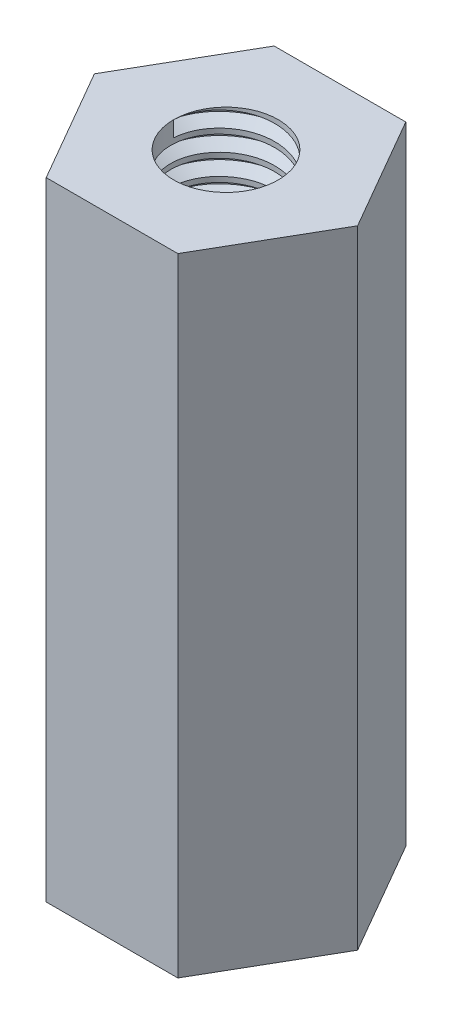
from build123d import *

# Parameters (mm, degrees)
SKETCH1_R           = 1.25
BOSS_EXTRUDE1_DEPTH = 15
THREAD1_PITCH       = 0.5


with BuildPart() as part:
    # Sketch1 → Boss-Extrude1 (new body)
    with BuildSketch(Plane(origin=(0, 0, 0), x_dir=(1, 0, 0), z_dir=(0, 1, 0))):
        Polygon((3.146558967, 0), (1.573279484, 2.725), (-1.573279484, 2.725), (-3.146558967, 0), (-1.573279484, -2.725), (1.573279484, -2.725), align=None)
        with Locations(Location((0, 0, 0), (0, 0, 270))):
            Circle(SKETCH1_R, mode=Mode.SUBTRACT)
    extrude(amount=BOSS_EXTRUDE1_DEPTH)

    # Thread1: the profile of Thread Profile1 profile screwed along a right-hand helix of 30 turns, 6 arcs to a turn; built about Z, then put on its axis
    thread1_z = Axis((0, 0, 0), (0, 0, 1))
    thread1_corners = [(1.2497, 0, -0.000173205), (1.520632938, 0, 0.156249999), (1.520632937, 0, 0.218749999), (1.2497, 0, 0.375173204)]
    with BuildLine(mode=Mode.PRIVATE) as thread1_profile:
        Line(thread1_corners[0], thread1_corners[1])
        Line(thread1_corners[1], thread1_corners[2])
        Line(thread1_corners[2], thread1_corners[3])
        Line(thread1_corners[3], thread1_corners[0])
    thread1_cap = Face(thread1_profile.wire())
    thread1_turn_angles = [0, 30, 60, 90, 120, 150, 180, 210, 240, 270, 300, 330, 360]
    thread1_turn_weights = [1, 0.8660254037844387, 1, 0.8660254037844387, 1, 0.8660254037844387, 1, 0.8660254037844387, 1, 0.8660254037844387, 1, 0.8660254037844387, 1]
    thread1_turn_rails = [Edge.make_bspline([Vector(p[0], p[1], 0).rotate(thread1_z, thread1_turn_angles[k]) / thread1_turn_weights[k] + Vector(0, 0, p[2] + THREAD1_PITCH * thread1_turn_angles[k] / 360) for k in range(13)], [0, 0, 0, 1, 1, 2, 2, 3, 3, 4, 4, 5, 5, 6, 6, 6], 2, thread1_turn_weights) for p in thread1_corners]
    thread1_turn_sides = [Face.make_surface_from_curves(thread1_turn_rails[p[0]], thread1_turn_rails[p[1]]) for p in [(0, 1), (1, 2), (2, 3), (3, 0)]]
    thread1 = Plane(origin=(0, 15, 0), x_dir=(-1, 0, 0), z_dir=(0, -1, 0)) * Solid(Shell([*[p.moved(Location((0, 0, THREAD1_PITCH * i))) for i in range(30) for p in thread1_turn_sides], thread1_cap, thread1_cap.rotate(thread1_z, 10800).moved(Location((0, 0, THREAD1_PITCH * 10800 / 360)))]))
    add(thread1, mode=Mode.SUBTRACT)


solid = part.part
